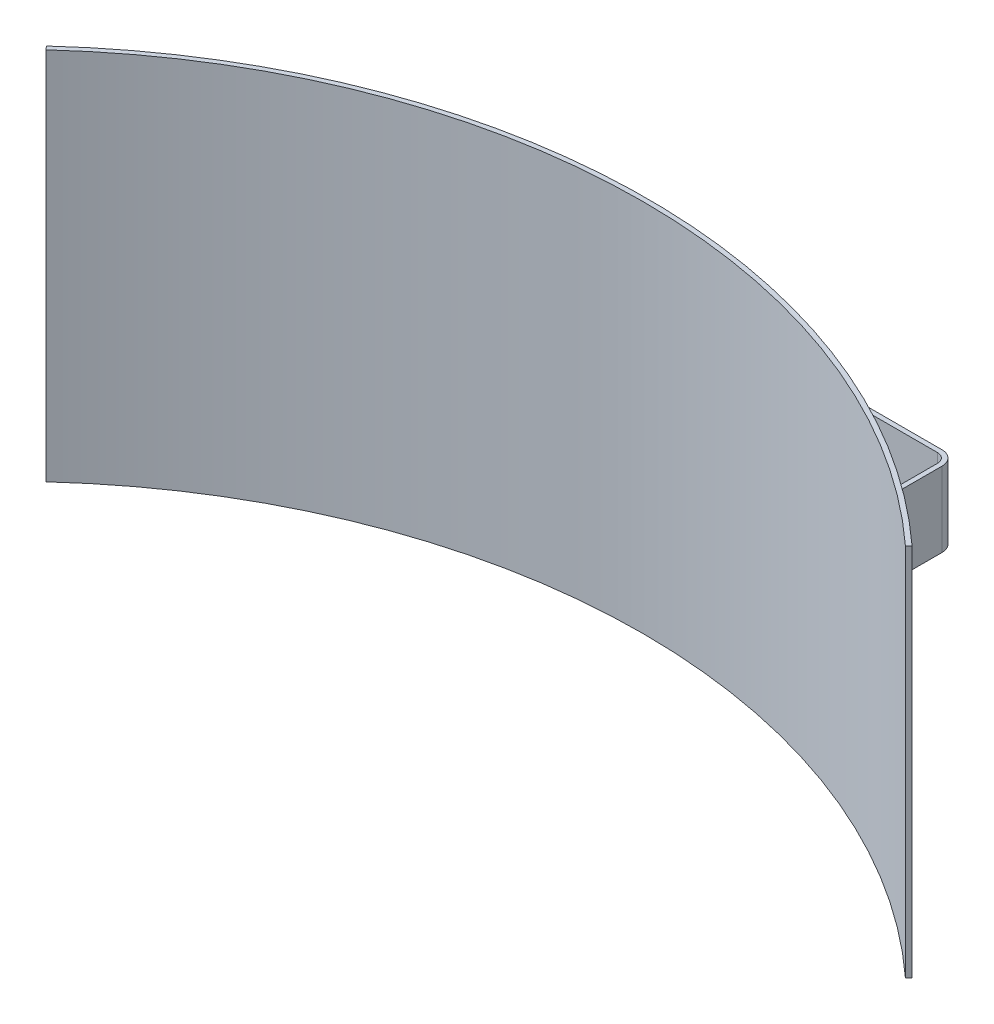
from build123d import *

# Parameters (mm, degrees)
BOSS_EXTRUDE1_DEPTH = 63.5
BOSS_EXTRUDE2_DEPTH = 12.7


with BuildPart() as part:
    # Sketch1 → Boss-Extrude1 (new, symmetric)
    with BuildSketch(Plane(origin=(0, 0, 0), x_dir=(1, 0, 0), z_dir=(0, 1, 0))):
        with BuildLine():
            Line((146.932425279, 160.348604789), (145.859925824, 159.178177017))
            ThreePointArc((145.859925824, 159.178177017), (0, 215.9), (-145.859925824, 159.178177017))
            Line((-145.859925824, 159.178177017), (-146.932425279, 160.348604789))
            ThreePointArc((-146.932425279, 160.348604789), (0, 217.4875), (146.932425279, 160.348604789))
        make_face()
    extrude(amount=BOSS_EXTRUDE1_DEPTH, both=True)

    # Sketch2 → Boss-Extrude2 (add, symmetric)
    with BuildSketch(Plane(origin=(0, 0, 0), x_dir=(1, 0, 0), z_dir=(0, 1, 0))):
        with BuildLine():
            Line((73.025, 242.8875), (-73.025, 242.8875))
            ThreePointArc((-73.025, 242.8875), (-75.27006403, 241.95756403), (-76.2, 239.7125))
            Line((-76.2, 239.7125), (-76.2, 205.89207921))
            ThreePointArc((-76.2, 205.89207921), (-76.757104939, 204.095624242), (-78.232913669, 202.92960325))
            ThreePointArc((-78.232913669, 202.92960325), (-90.073473692, 197.958536045), (-101.6, 192.297302779))
            Line((-101.6, 192.297302779), (-102.341605839, 193.700932727))
            ThreePointArc((-102.341605839, 193.700932727), (-90.730944303, 199.403488863), (-78.803956835, 204.41084123))
            ThreePointArc((-78.803956835, 204.41084123), (-78.06605247, 204.993851726), (-77.7875, 205.89207921))
            Line((-77.7875, 205.89207921), (-77.7875, 239.7125))
            ThreePointArc((-77.7875, 239.7125), (-76.392596045, 243.080096045), (-73.025, 244.475))
            Line((-73.025, 244.475), (73.025, 244.475))
            ThreePointArc((73.025, 244.475), (76.392596045, 243.080096045), (77.7875, 239.7125))
            Line((77.7875, 239.7125), (77.7875, 205.89207921))
            ThreePointArc((77.7875, 205.89207921), (78.06605247, 204.993851726), (78.803956835, 204.41084123))
            ThreePointArc((78.803956835, 204.41084123), (90.730944303, 199.403488863), (102.341605839, 193.700932727))
            Line((102.341605839, 193.700932727), (101.6, 192.297302779))
            ThreePointArc((101.6, 192.297302779), (90.073473692, 197.958536045), (78.232913669, 202.92960325))
            ThreePointArc((78.232913669, 202.92960325), (76.757104939, 204.095624242), (76.2, 205.89207921))
            Line((76.2, 205.89207921), (76.2, 239.7125))
            ThreePointArc((76.2, 239.7125), (75.27006403, 241.95756403), (73.025, 242.8875))
        make_face()
    extrude(amount=BOSS_EXTRUDE2_DEPTH, both=True)


solid = part.part
